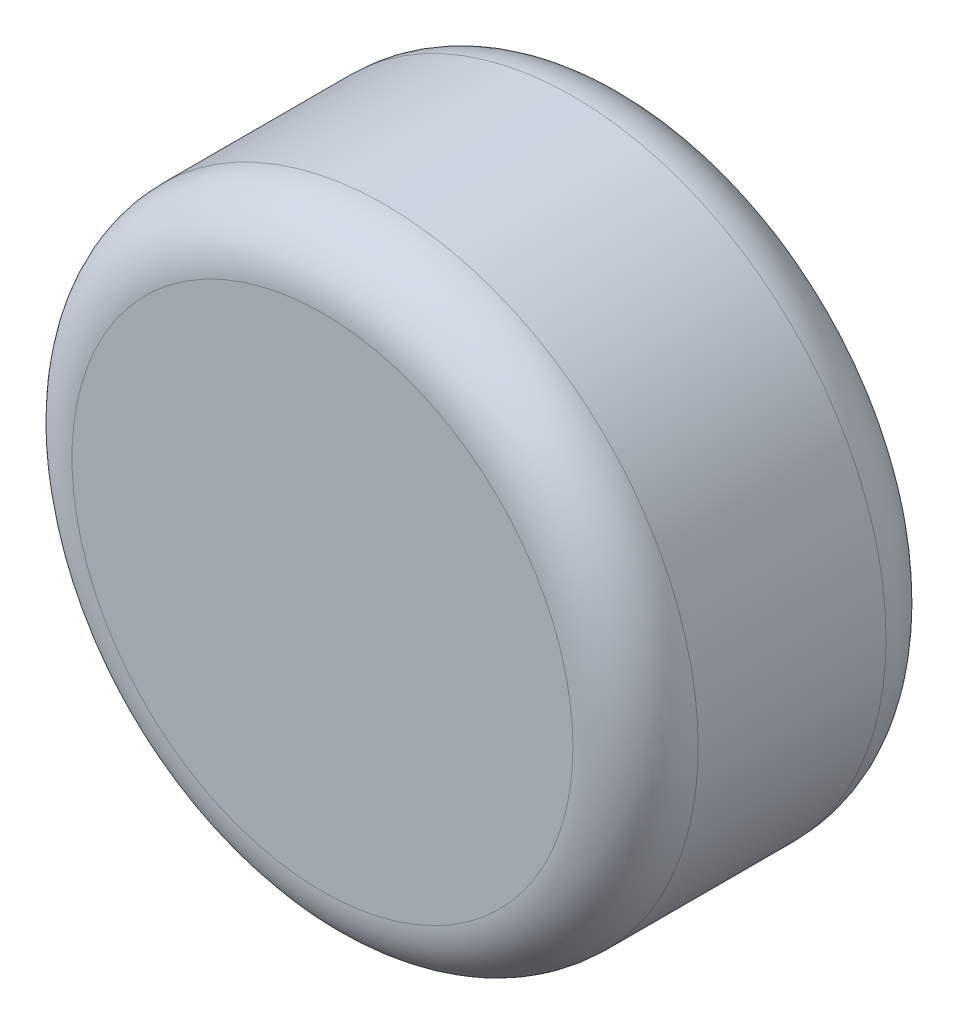
from build123d import *

# Parameters (mm, degrees)
SKETCH_2_R      = 50
EXTRUDE_2_DEPTH = 50
FILLET_1_R      = 10


with BuildPart() as part:
    # ｽｹｯﾁ2 → ﾎﾞｽ - 押し出し2 (new body)
    with BuildSketch(Plane.XY):
        Circle(SKETCH_2_R)
    extrude(amount=EXTRUDE_2_DEPTH)

    # ﾌｨﾚｯﾄ1
    fillet_1_edges = [part.edges().sort_by_distance(p)[0] for p in [
        (-50, 0, 50),
        (-50, 0, 0),
    ]]
    fillet(fillet_1_edges, radius=FILLET_1_R)


solid = part.part
